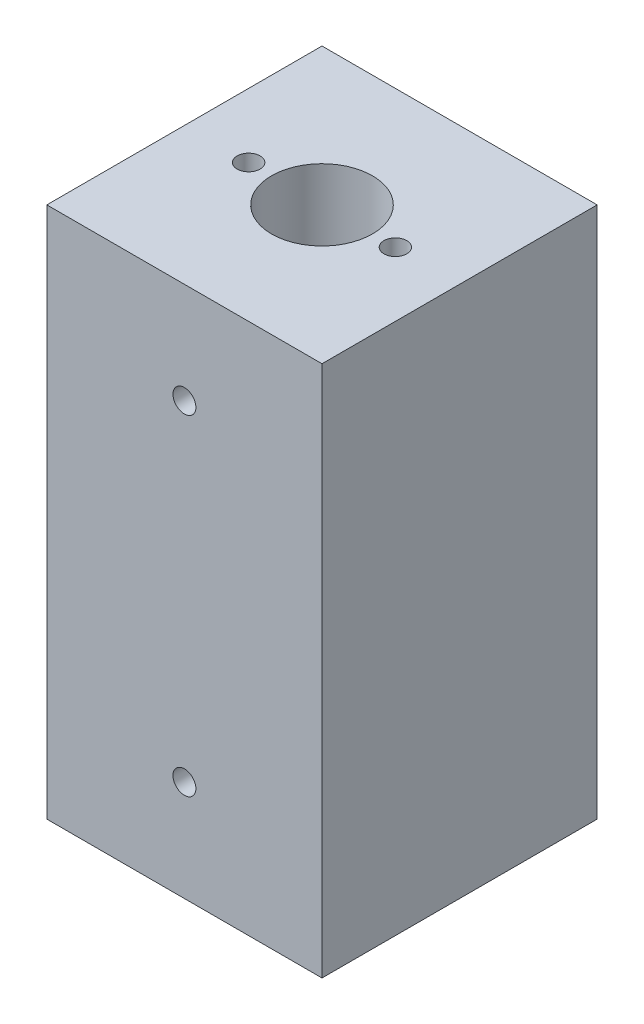
from build123d import *

# Parameters (mm, degrees)
SKETCH1_W           = 30
SKETCH1_H           = 30
BOSS_EXTRUDE1_DEPTH = 58
SKETCH2_R           = 5.5
SKETCH2_R_2         = 1.25
CUT_EXTRUDE1_DEPTH  = 10
SKETCH3_R           = 5.5
CUT_EXTRUDE2_DEPTH  = 53.478567054
SKETCH4_R           = 1.25
CUT_EXTRUDE3_DEPTH  = 8


with BuildPart() as part:
    # Sketch1 → Boss-Extrude1 (new body)
    with BuildSketch(Plane(origin=(0, 0, 0), x_dir=(1, 0, 0), z_dir=(0, 1, 0))):
        Rectangle(SKETCH1_W, SKETCH1_H)
    extrude(amount=BOSS_EXTRUDE1_DEPTH)

    # Sketch2 → Cut-Extrude1 (cut)
    with BuildSketch(Plane(origin=(0, 58, 0), x_dir=(1, 0, 0), z_dir=(0, 1, 0))):
        Circle(SKETCH2_R)
        with Locations((8, 0)):
            Circle(SKETCH2_R_2)
        with Locations((-8, 0)):
            Circle(SKETCH2_R_2)
    extrude(amount=-CUT_EXTRUDE1_DEPTH, mode=Mode.SUBTRACT)

    # Sketch3 → Cut-Extrude2 (cut, through all)
    with BuildSketch(Plane(origin=(0, 48, 0), x_dir=(1, 0, 0), z_dir=(0, 1, 0))):
        Circle(SKETCH3_R)
    extrude(amount=-CUT_EXTRUDE2_DEPTH, mode=Mode.SUBTRACT)

    # Sketch4 → Cut-Extrude3 (cut)
    with BuildSketch(Plane.XY.offset(15)):
        with Locations((0, 47)):
            Circle(SKETCH4_R)
        with Locations((0, 11)):
            Circle(SKETCH4_R)
    cut_extrude3 = extrude(amount=-CUT_EXTRUDE3_DEPTH, mode=Mode.SUBTRACT)

    # Mirror1: Cut-Extrude3 across plane
    add(cut_extrude3.mirror(Plane.XY), mode=Mode.SUBTRACT)


solid = part.part
